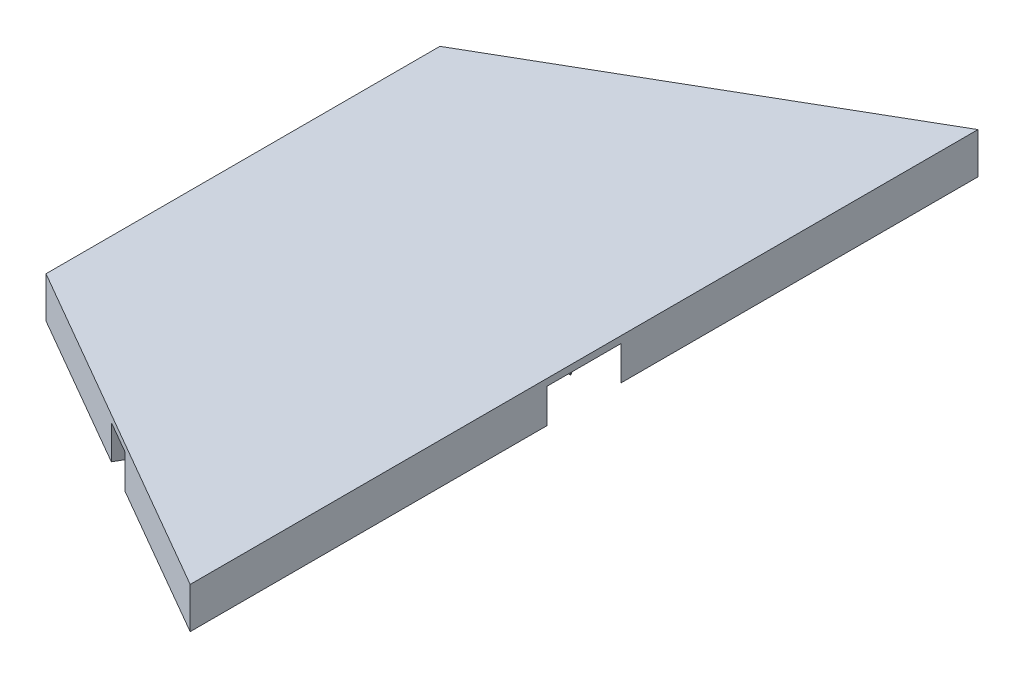
from build123d import *

# Parameters (mm, degrees)
BOSS_EXTRUDE1_DEPTH     = 6
SKETCH2_W               = 100
SKETCH2_H               = 5.4
CUT_EXTRUDE_THIN1_DEPTH = 5
INTERSECT1_DEPTH        = 50


# Read off the part's stored shape, not the designer's step: Intersect1
with BuildPart() as part:
    # Sketch1 → Boss-Extrude1 (new body)
    with BuildSketch(Plane(origin=(0, 0, 0), x_dir=(1, 0, 0), z_dir=(0, 1, 0))):
        Polygon((0, 57.735026919), (-50, 28.867513459), (-50, -28.867513459), (0, -57.735026919), (50, -28.867513459), (50, 28.867513459), align=None)
    extrude(amount=BOSS_EXTRUDE1_DEPTH)

    # Sketch2 → Cut-Extrude-Thin1 (cut)
    with BuildSketch(Plane.XZ):
        Polygon((-27.33826859, 41.951270189), (22.66173141, -44.651270189), (27.33826859, -41.951270189), (-22.66173141, 44.651270189), align=None)
        Polygon((22.66173141, 44.651270189), (-27.33826859, -41.951270189), (-22.66173141, -44.651270189), (27.33826859, 41.951270189), align=None)
        Rectangle(SKETCH2_W, SKETCH2_H)
    extrude(amount=-CUT_EXTRUDE_THIN1_DEPTH, mode=Mode.SUBTRACT)

    # Intersect1 outline → Intersect1 (cut)
    with BuildSketch(Plane.YZ):
        Polygon((0, 2.7), (5, 2.7), (5, -2.7), (0, -2.7), (0, -59), (6, -59), (6, 59), (0, 59), align=None)
    extrude(amount=INTERSECT1_DEPTH, mode=Mode.SUBTRACT)


solid = part.part
